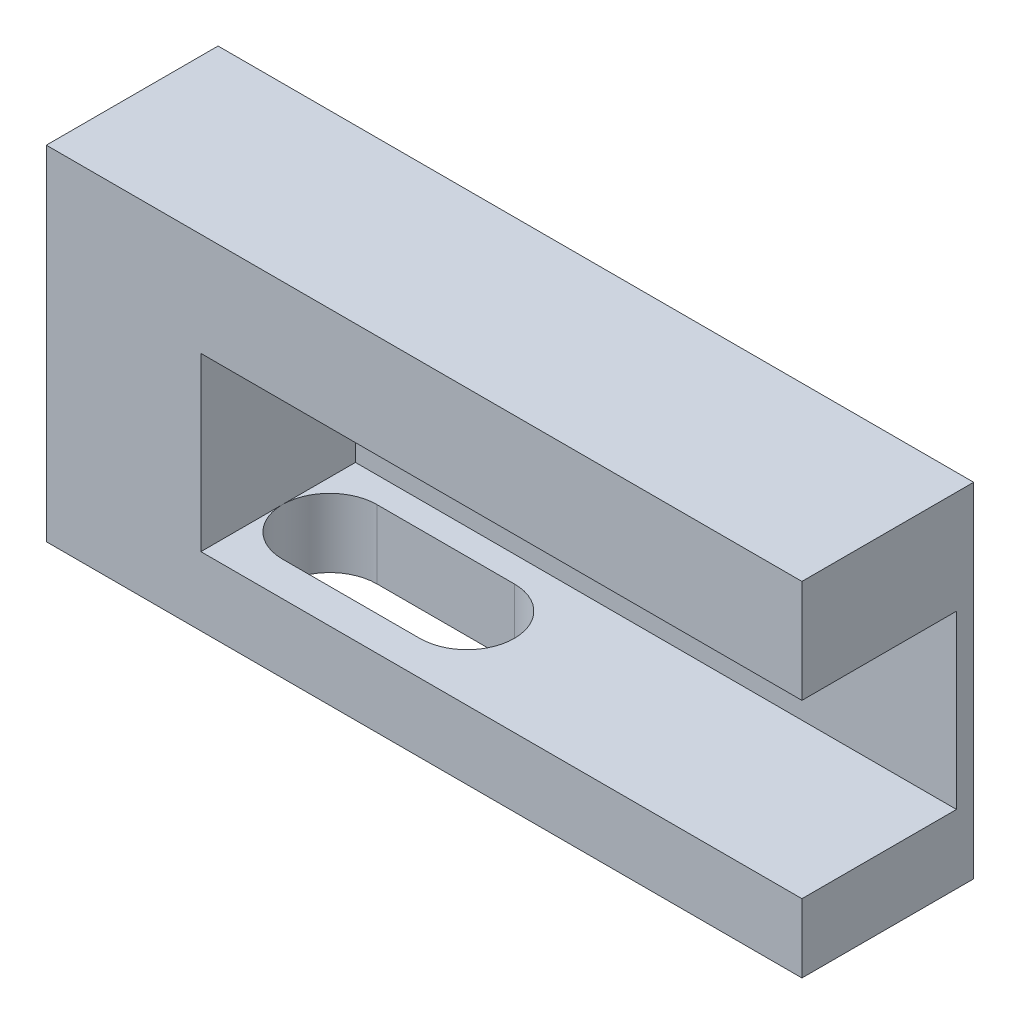
from build123d import *

# Parameters (mm, degrees)
RESSALTO_EXTRUS_O1_DEPTH   = 5
CORTE_EXTRUS_O1_DEPTH      = 83.83115356
CORTE_EXTRUS_O1_DEPTH_BACK = 4
ESBO_O5_W                  = 35
ESBO_O5_H                  = 10
RESSALTO_EXTRUS_O2_DEPTH   = 5
FILETE1_R                  = 5
CORTE_EXTRUS_O2_DEPTH      = 83.83115356
CORTE_EXTRUS_O3_DEPTH      = 5
FILETE2_R                  = 2
ESBO_O10_W                 = 20
ESBO_O10_H                 = 50
CORTE_EXTRUS_O4_DEPTH      = 84.282651255


with BuildPart() as part:
    # Esboço1 → Ressalto-extrusão1 (new body)
    with BuildSketch(Plane.XY):
        Polygon((0, 0), (0, 70), (20, 70), (20, 20), (44, 20), (44, 0), align=None)
    extrude(amount=RESSALTO_EXTRUS_O1_DEPTH)

    # Esboço5 → Corte-extrusão1 (cut, two sides: drawn at the far end of the back side and taken through both)
    with BuildSketch(Plane.XY.offset(5).offset(-CORTE_EXTRUS_O1_DEPTH_BACK)):
        with Locations((26.5, 9)):
            Rectangle(ESBO_O5_W, ESBO_O5_H)
    extrude(amount=CORTE_EXTRUS_O1_DEPTH + CORTE_EXTRUS_O1_DEPTH_BACK, mode=Mode.SUBTRACT)

    # Esboço6 → Ressalto-extrusão2 (add)
    with BuildSketch(Plane.XY.offset(5)):
        Polygon((44, 20), (0, 20), (0, 0), (44, 0), (44, 4), (9, 4), (9, 14), (44, 14), align=None)
    extrude(amount=RESSALTO_EXTRUS_O2_DEPTH)

    # Filete1
    filete1_edges = [part.edges().sort_by_distance(p)[0] for p in [
        (10, 20, 5),
    ]]
    fillet(filete1_edges, radius=FILETE1_R - 0.0001)  # a hair under: the kernel refuses the full size

    # Esboço7 → Corte-extrusão2 (cut, through all)
    with BuildSketch(Plane.XY.offset(5)):
        with BuildLine():
            Line((12.75, 65), (12.75, 55))
            ThreePointArc((12.75, 55), (10, 52.25), (7.25, 55))
            Line((7.25, 55), (7.25, 65))
            ThreePointArc((7.25, 65), (10, 67.75), (12.75, 65))
        make_face()
    extrude(amount=-CORTE_EXTRUS_O2_DEPTH, mode=Mode.SUBTRACT)

    # Esboço8 → Corte-extrusão3 (cut)
    with BuildSketch(Plane.XZ):
        with BuildLine():
            Line((11.75, 8), (19.75, 8))
            ThreePointArc((19.75, 8), (22.5, 5.25), (19.75, 2.5))
            Line((19.75, 2.5), (11.75, 2.5))
            ThreePointArc((11.75, 2.5), (9, 5.25), (11.75, 8))
        make_face()
    extrude(amount=-CORTE_EXTRUS_O3_DEPTH, mode=Mode.SUBTRACT)

    # Filete2
    filete2_edges = [part.edges().sort_by_distance(p)[0] for p in [
        (0, 70, 2.5),
        (20, 70, 2.5),
    ]]
    fillet(filete2_edges, radius=FILETE2_R)

    # Esboço10 → Corte-extrusão4 (cut, through all)
    with BuildSketch(Plane.XY.offset(10)):
        with Locations((10, 45)):
            Rectangle(ESBO_O10_W, ESBO_O10_H)
    extrude(amount=-CORTE_EXTRUS_O4_DEPTH, mode=Mode.SUBTRACT)


solid = part.part
